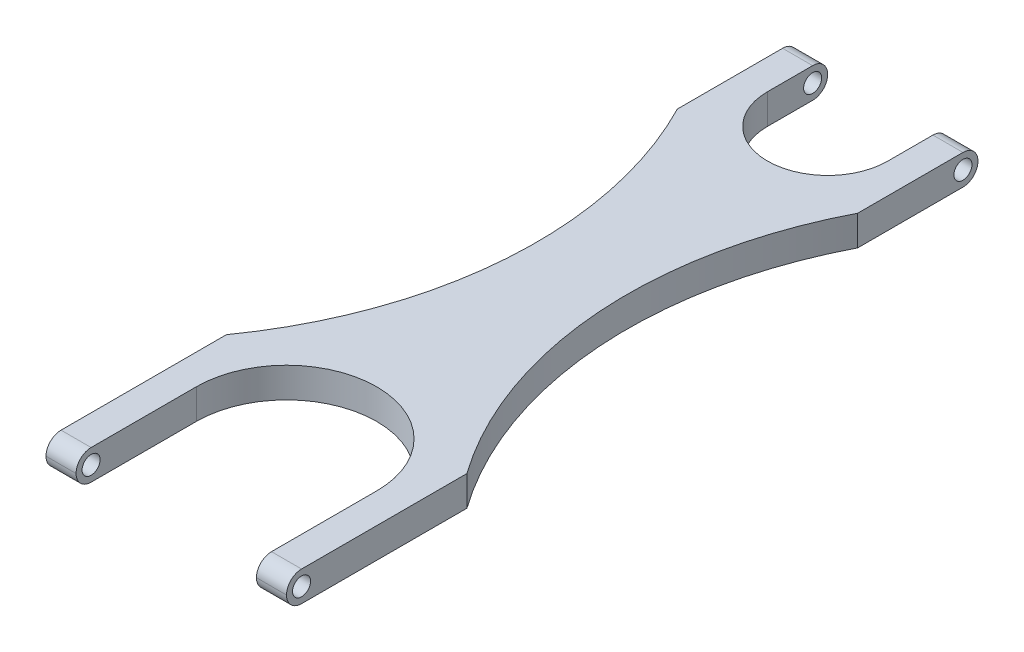
from build123d import *

# Parameters (mm, degrees)
BOSS_EXTRUDE1_DEPTH = 12.7
FILLET1_R           = 6.35
SKETCH2_R           = 3.81
CUT_EXTRUDE1_DEPTH  = 322.53831809
SKETCH3_R           = 3.81
CUT_EXTRUDE2_DEPTH  = 318.753898481


with BuildPart() as part:
    # Sketch1 → Boss-Extrude1 (new body)
    with BuildSketch(Plane(origin=(0, 0, 0), x_dir=(1, 0, 0), z_dir=(0, 1, 0))):
        with BuildLine():
            Line((0, 0), (12.7, 0))
            Line((12.7, 0), (12.7, -25.4))
            ThreePointArc((12.7, -25.4), (20.139487758, -43.360512242), (38.1, -50.8))
            ThreePointArc((38.1, -50.8), (56.060512242, -43.360512242), (63.5, -25.4))
            Line((63.5, -25.4), (63.5, 0))
            Line((63.5, 0), (76.2, 0))
            Line((76.2, 0), (76.2, -50.8))
            ThreePointArc((76.2, -50.8), (57.621017373, -141.480641616), (88.9, -228.6))
            Line((88.9, -228.6), (88.9, -304.8))
            Line((88.9, -304.8), (76.2, -304.8))
            Line((76.2, -304.8), (76.2, -254))
            ThreePointArc((76.2, -254), (65.040768363, -227.059231637), (38.1, -215.9))
            ThreePointArc((38.1, -215.9), (11.159231637, -227.059231637), (0, -254))
            Line((0, -254), (0, -304.8))
            Line((0, -304.8), (-12.7, -304.8))
            Line((-12.7, -304.8), (-12.7, -228.6))
            ThreePointArc((-12.7, -228.6), (18.578982627, -141.480641616), (0, -50.8))
            Line((0, -50.8), (0, 0))
        make_face()
    extrude(amount=BOSS_EXTRUDE1_DEPTH)

    # Fillet1
    fillet1_edges = [part.edges().sort_by_distance(p)[0] for p in [
        (69.85, 0, 0),
        (6.35, 0, 0),
        (69.85, 12.7, 0),
        (6.35, 12.7, 0),
        (-6.35, 0, 304.8),
        (-6.35, 12.7, 304.8),
        (82.55, 0, 304.8),
        (82.55, 12.7, 304.8),
    ]]
    fillet(fillet1_edges, radius=FILLET1_R - 0.0001)  # a hair under: the kernel refuses the full size

    # Sketch2 → Cut-Extrude1 (cut, through all)
    with BuildSketch(Plane(origin=(88.9, 0, 0), x_dir=(0, 0, -1), z_dir=(1, 0, 0))):
        with Locations((-298.45, 6.35)):
            Circle(SKETCH2_R)
    extrude(amount=-CUT_EXTRUDE1_DEPTH, mode=Mode.SUBTRACT)

    # Sketch3 → Cut-Extrude2 (cut, through all)
    with BuildSketch(Plane(origin=(76.2, 0, 0), x_dir=(0, 0, -1), z_dir=(1, 0, 0))):
        with Locations((-6.35, 6.35)):
            Circle(SKETCH3_R)
    extrude(amount=-CUT_EXTRUDE2_DEPTH, mode=Mode.SUBTRACT)


solid = part.part
